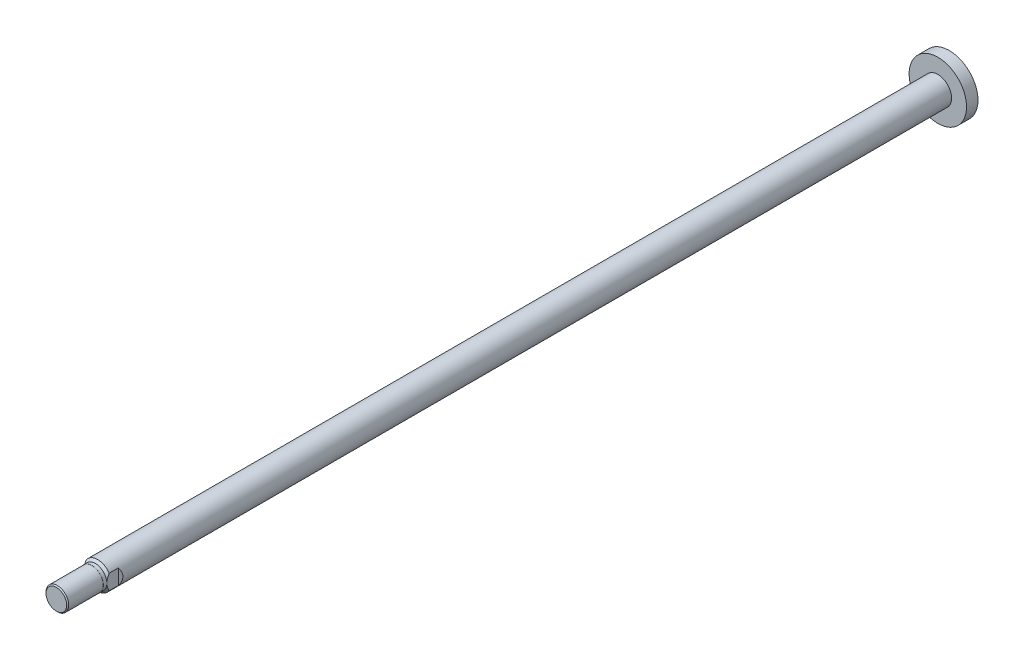
from build123d import *

# Parameters (mm, degrees)
SKETCH1_R           = 12.5
PISTON_DEPTH        = 5
SKETCH2_R           = 6
ROD_DEPTH           = 389
THREADS_START       = -18
SKETCH3_R           = 6
SKETCH3_R_2         = 5
THREADS_DEPTH       = 18
ROD_CHAMFER_SIZE    = 1
WRENCH_FLAT_DEPTH   = 390.401463788
THREAD_CHAMFER_SIZE = 0.5
CUT_EXTRUDE1_START  = -15.5
SKETCH5_R           = 5
SKETCH5_R_2         = 4.95
CUT_EXTRUDE1_DEPTH  = 15.5


with BuildPart() as part:
    # Sketch1 → Piston (new body)
    with BuildSketch(Plane.XY):
        Circle(SKETCH1_R)
    extrude(amount=PISTON_DEPTH)

    # Sketch2 → Rod (add)
    with BuildSketch(Plane.XY):
        Circle(SKETCH2_R)
    extrude(amount=ROD_DEPTH)

    # Sketch3 → Threads (cut)
    with BuildSketch(Plane.XY.offset(389).offset(THREADS_START)):
        Circle(SKETCH3_R)
        Circle(SKETCH3_R_2, mode=Mode.SUBTRACT)
    extrude(amount=THREADS_DEPTH, mode=Mode.SUBTRACT)

    # Rod Chamfer
    rod_chamfer_edges = [part.edges().sort_by_distance(p)[0] for p in [
        (-5, 0, 371),
    ]]
    chamfer(rod_chamfer_edges, length=ROD_CHAMFER_SIZE - 0.0001)  # a hair under: the kernel refuses the full size

    # Sketch4 → Wrench Flat (cut, symmetric)
    with BuildSketch(Plane(origin=(0, 0, 0), x_dir=(1, 0, 0), z_dir=(0, 1, 0))):
        Polygon((5, -372), (5, -367), (6, -366), (6, -372), align=None)
    wrench_flat = extrude(amount=WRENCH_FLAT_DEPTH, both=True, mode=Mode.SUBTRACT)

    # Mirror1: Wrench Flat across plane
    add(wrench_flat.mirror(Plane(origin=(0, 0, 0), x_dir=(0, 0, 1), z_dir=(1, 0, 0))), mode=Mode.SUBTRACT)

    # Thread Chamfer
    thread_chamfer_edges = [part.edges().sort_by_distance(p)[0] for p in [
        (-5, 0, 389),
    ]]
    chamfer(thread_chamfer_edges, length=THREAD_CHAMFER_SIZE)

    # Sketch5 → Cut-Extrude1 (cut)
    with BuildSketch(Plane.XY.offset(389).offset(CUT_EXTRUDE1_START)):
        Circle(SKETCH5_R)
        Circle(SKETCH5_R_2, mode=Mode.SUBTRACT)
    extrude(amount=CUT_EXTRUDE1_DEPTH, mode=Mode.SUBTRACT)


solid = part.part
